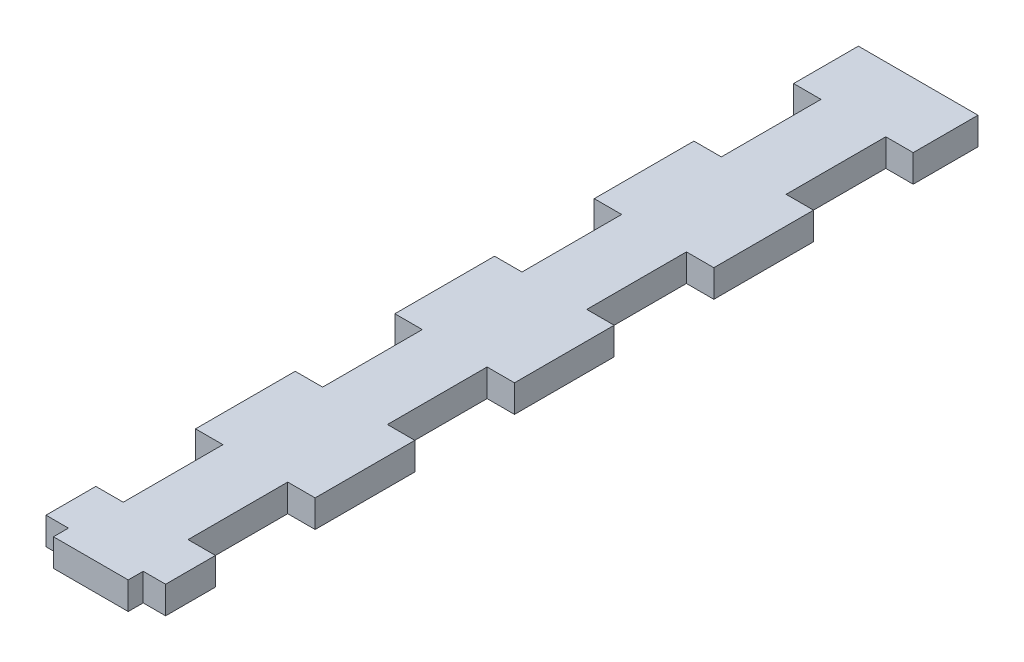
from build123d import *

# Parameters (mm, degrees)
SALIENTE_EXTRUIR1_DEPTH = 5.5


with BuildPart() as part:
    # Croquis1 → Saliente-Extruir1 (new body)
    with BuildSketch(Plane(origin=(0, 0, 0), x_dir=(1, 0, 0), z_dir=(0, 1, 0))):
        Polygon((4.5, 3), (4.5, 0), (12, 0), (19.5, 0), (19.5, 3), (24, 3), (24, 13), (18.5, 13), (18.5, 33), (24, 33), (24, 53), (18.5, 53), (18.5, 73), (24, 73), (24, 93), (18.5, 93), (18.5, 113), (24, 113), (24, 133), (18.5, 133), (18.5, 153), (24, 153), (24, 166), (0, 166), (0, 153), (5.5, 153), (5.5, 133), (0, 133), (0, 113), (5.5, 113), (5.5, 93), (0, 93), (0, 83), (0, 73), (5.5, 73), (5.5, 53), (0, 53), (0, 33), (5.5, 33), (5.5, 13), (0, 13), (0, 3), align=None)
    extrude(amount=SALIENTE_EXTRUIR1_DEPTH)


solid = part.part
